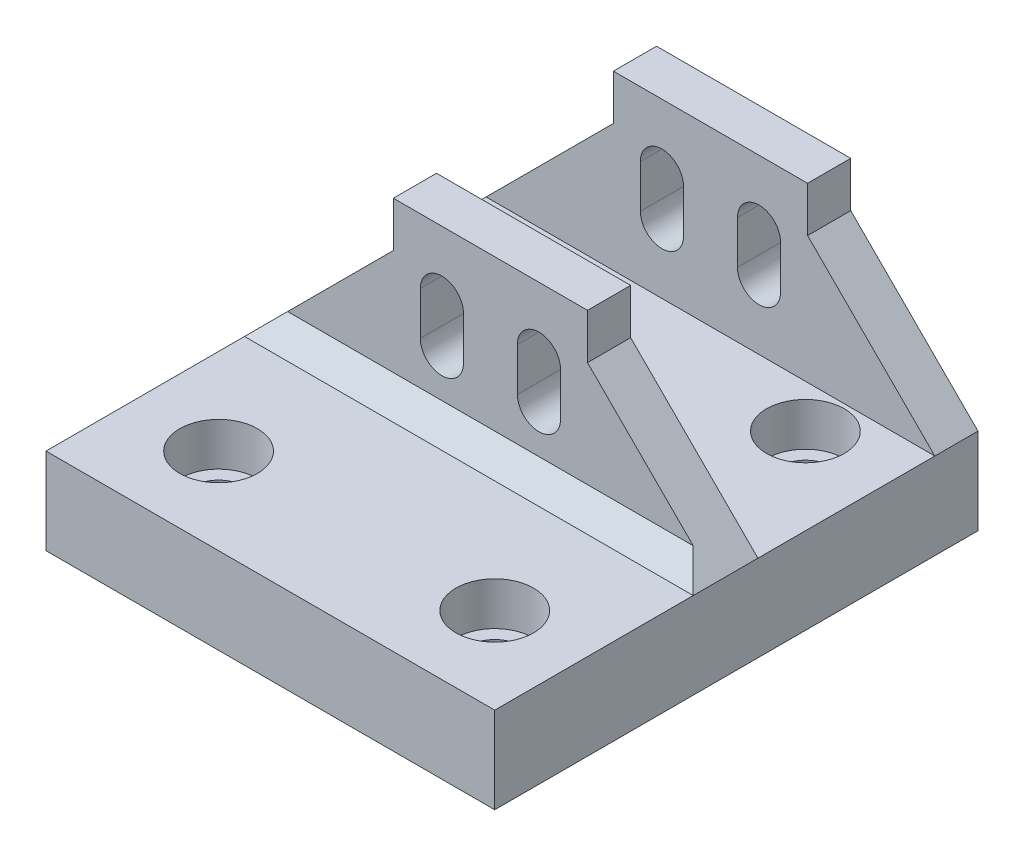
from build123d import *

# Parameters (mm, degrees)
SKETCH1_W               = 52
SKETCH1_H               = 56
SKETCH1_R               = 2.95
BOSS_EXTRUDE1_DEPTH     = 10
CUT_EXTRUDE1_DEPTH      = 78.071395472
CUT_EXTRUDE1_DEPTH_BACK = 5
SKETCH2_R               = 4.5
BOSS_EXTRUDE2_START     = -14.75
SKETCH3_W               = 5
SKETCH3_H               = 20
BOSS_EXTRUDE2_DEPTH     = 22.5
CUT_EXTRUDE2_REACH      = 69.337
CHAMFER1_SIZE           = 14.75
CHAMFER2_SIZE           = 2.5


with BuildPart() as part:
    # Sketch1 → Boss-Extrude1 (new body)
    with BuildSketch(Plane(origin=(0, 0, 0), x_dir=(1, 0, 0), z_dir=(0, 1, 0))):
        with Locations((26, 28)):
            Rectangle(SKETCH1_W, SKETCH1_H)
        with Locations(Location((10, 46, 0), (0, 0, 270))):
            Circle(SKETCH1_R, mode=Mode.SUBTRACT)
        with Locations(Location((42, 46, 0), (0, 0, 270))):
            Circle(SKETCH1_R, mode=Mode.SUBTRACT)
        with Locations(Location((42, 10, 0), (0, 0, 270))):
            Circle(SKETCH1_R, mode=Mode.SUBTRACT)
        with Locations(Location((10, 10, 0), (0, 0, 270))):
            Circle(SKETCH1_R, mode=Mode.SUBTRACT)
    extrude(amount=BOSS_EXTRUDE1_DEPTH)

    # Sketch2 → Cut-Extrude1 (cut, two sides: drawn at the far end of the back side and taken through both)
    with BuildSketch(Plane(origin=(0, 10, 0), x_dir=(1, 0, 0), z_dir=(0, 1, 0)).offset(-CUT_EXTRUDE1_DEPTH_BACK)):
        with Locations(Location((10, 10, 0), (0, 0, 90))):
            Circle(SKETCH2_R)
        with Locations(Location((42, 10, 0), (0, 0, 90))):
            Circle(SKETCH2_R)
        with Locations(Location((42, 46, 0), (0, 0, 90))):
            Circle(SKETCH2_R)
        with Locations(Location((10, 46, 0), (0, 0, 90))):
            Circle(SKETCH2_R)
    extrude(amount=CUT_EXTRUDE1_DEPTH + CUT_EXTRUDE1_DEPTH_BACK, mode=Mode.SUBTRACT)

    # Sketch3 → Boss-Extrude2 (add)
    with BuildSketch(Plane(origin=(52, 0, 0), x_dir=(0, 0, -1), z_dir=(1, 0, 0)).offset(BOSS_EXTRUDE2_START)):
        with Locations((28, 20)):
            Rectangle(SKETCH3_W, SKETCH3_H)
        with Locations((53.5, 20)):
            Rectangle(SKETCH3_W, SKETCH3_H)
    extrude(amount=-BOSS_EXTRUDE2_DEPTH)

    # Cut-Extrude2: up to this face of the body (flat: up to its plane)
    cut_extrude2_end = Plane(part.part.faces().sort_by_distance((26, 11.958762887, -56))[0])
    # Sketch4 → Cut-Extrude2 (cut, up to the picked face)
    with BuildSketch(Plane.XY.offset(-25.5), mode=Mode.PRIVATE) as cut_extrude2_sk1:
        with BuildLine():
            Line((22.875, 22.5), (22.875, 17.5))
            ThreePointArc((22.875, 17.5), (20.375, 15), (17.875, 17.5))
            Line((17.875, 17.5), (17.875, 22.5))
            ThreePointArc((17.875, 22.5), (20.375, 25), (22.875, 22.5))
        make_face()
    cut_extrude2_tool1 = split(extrude(cut_extrude2_sk1.sketch, amount=-CUT_EXTRUDE2_REACH, mode=Mode.PRIVATE), bisect_by=cut_extrude2_end, keep=Keep.BOTH, mode=Mode.PRIVATE)
    # Sketch4 → Cut-Extrude2 (cut, up to the picked face)
    with BuildSketch(Plane.XY.offset(-25.5), mode=Mode.PRIVATE) as cut_extrude2_sk2:
        with BuildLine():
            Line((34.125, 22.5), (34.125, 17.5))
            ThreePointArc((34.125, 17.5), (31.625, 15), (29.125, 17.5))
            Line((29.125, 17.5), (29.125, 22.5))
            ThreePointArc((29.125, 22.5), (31.625, 25), (34.125, 22.5))
        make_face()
    cut_extrude2_tool2 = split(extrude(cut_extrude2_sk2.sketch, amount=-CUT_EXTRUDE2_REACH, mode=Mode.PRIVATE), bisect_by=cut_extrude2_end, keep=Keep.BOTH, mode=Mode.PRIVATE)
    add(cut_extrude2_tool1.solids().sort_by(Axis((20.375, 20, -25.5), (0, 0, -1)))[0], mode=Mode.SUBTRACT)
    add(cut_extrude2_tool2.solids().sort_by(Axis((31.625, 20, -25.5), (0, 0, -1)))[0], mode=Mode.SUBTRACT)

    # Chamfer1
    chamfer1_edges = [part.edges().sort_by_distance(p)[0] for p in [
        (37.25, 10, -53.5),
        (37.25, 10, -28),
        (14.75, 10, -53.5),
        (14.75, 10, -28),
    ]]
    chamfer(chamfer1_edges, length=CHAMFER1_SIZE - 0.0001)  # a hair under: the kernel refuses the full size

    # Chamfer2
    chamfer2_edges = [part.edges().sort_by_distance(p)[0] for p in [
        (26, 10, -25.5),
    ]]
    chamfer(chamfer2_edges, length=CHAMFER2_SIZE)


solid = part.part
